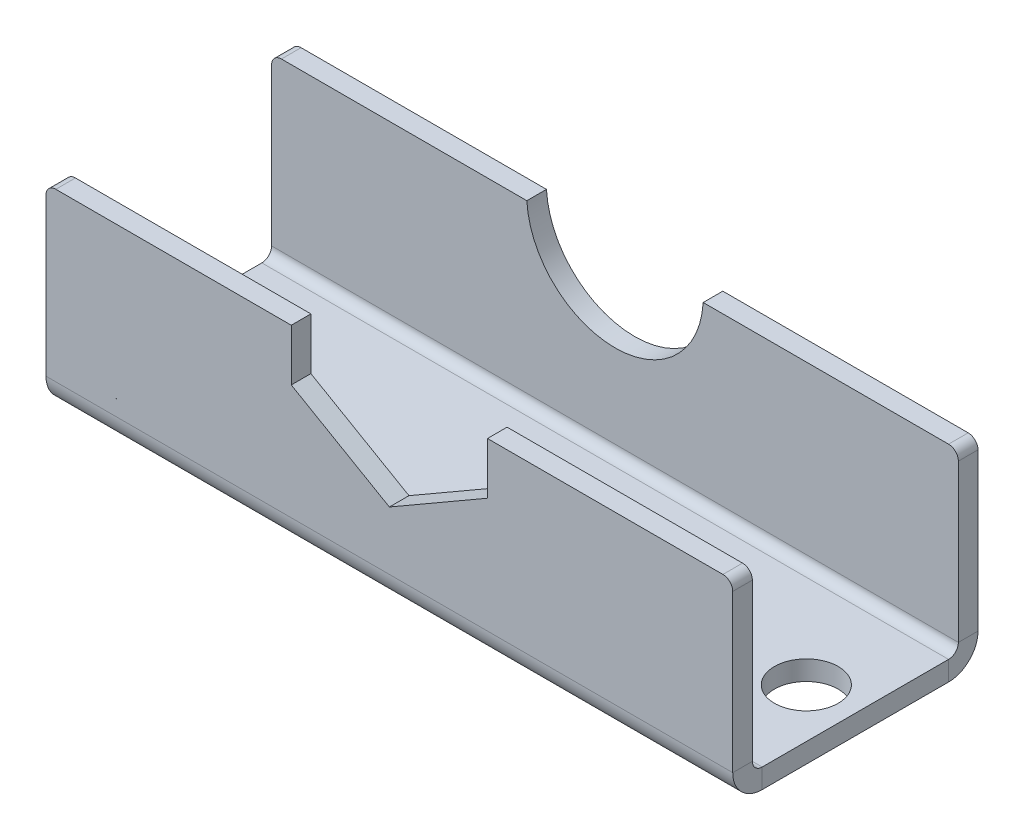
from build123d import *

# Parameters (mm, degrees)
BASE_FLANGE1_DEPTH = 70
CUT_EXTRUDE1_REACH = 78.974
CUT_EXTRUDE2_REACH = 78.348
SKETCH7_R          = 9
CUT_EXTRUDE3_REACH = 75.866
SKETCH8_R          = 3.25
FILLET1_R          = 1


# Sheet-metal steps are written as plain solids
with BuildPart() as part:
    # Sketch1 → Base-Flange1 (new body)
    with BuildSketch(Plane(origin=(0, 0, 0), x_dir=(0, 0, -1), z_dir=(1, 0, 0))):
        with BuildLine():
            Line((-12.5, 20), (-12.5, 3))
            ThreePointArc((-12.5, 3), (-11.621320344, 0.878679656), (-9.5, 0))
            Line((-9.5, 0), (9.5, 0))
            ThreePointArc((9.5, 0), (11.621320344, 0.878679656), (12.5, 3))
            Line((12.5, 3), (12.5, 20))
            Line((12.5, 20), (10.5, 20))
            Line((10.5, 20), (10.5, 3))
            ThreePointArc((10.5, 3), (10.207106781, 2.292893219), (9.5, 2))
            Line((9.5, 2), (-9.5, 2))
            ThreePointArc((-9.5, 2), (-10.207106781, 2.292893219), (-10.5, 3))
            Line((-10.5, 3), (-10.5, 20))
            Line((-10.5, 20), (-12.5, 20))
        make_face()
    extrude(amount=BASE_FLANGE1_DEPTH)

    # Sketch6 → Cut-Extrude1 (cut, up to next)
    with BuildSketch(Plane.XY.offset(12.5), mode=Mode.PRIVATE) as cut_extrude1_sk1:
        Polygon((35, 8.952994616), (45, 14.726497308), (45, 26.273502692), (35, 32.047005384), (25, 26.273502692), (25, 14.726497308), align=None)
    cut_extrude1_tool1 = extrude(cut_extrude1_sk1.sketch, amount=-CUT_EXTRUDE1_REACH, mode=Mode.PRIVATE) & part.part
    add(cut_extrude1_tool1.solids().sort_by_distance((35, 20.5, 12.5))[0], mode=Mode.SUBTRACT)

    # Sketch7 → Cut-Extrude2 (cut, up to next)
    with BuildSketch(Plane.XY.offset(-10.5), mode=Mode.PRIVATE) as cut_extrude2_sk1:
        with Locations((35, 20.5)):
            Circle(SKETCH7_R)
    cut_extrude2_tool1 = extrude(cut_extrude2_sk1.sketch, amount=-CUT_EXTRUDE2_REACH, mode=Mode.PRIVATE) & part.part
    add(cut_extrude2_tool1.solids().sort_by_distance((35, 20.5, -10.5))[0], mode=Mode.SUBTRACT)

    # Sketch8 → Cut-Extrude3 (cut, up to next)
    with BuildSketch(Plane.XZ, mode=Mode.PRIVATE) as cut_extrude3_sk1:
        with Locations(Location((65, 0, 0), (0, 0, 270))):
            Circle(SKETCH8_R)
    cut_extrude3_tool1 = extrude(cut_extrude3_sk1.sketch, amount=-CUT_EXTRUDE3_REACH, mode=Mode.PRIVATE) & part.part
    # Sketch8 → Cut-Extrude3 (cut, up to next)
    with BuildSketch(Plane.XZ, mode=Mode.PRIVATE) as cut_extrude3_sk2:
        with Locations(Location((5, 0, 0), (0, 0, 270))):
            Circle(SKETCH8_R)
    cut_extrude3_tool2 = extrude(cut_extrude3_sk2.sketch, amount=-CUT_EXTRUDE3_REACH, mode=Mode.PRIVATE) & part.part
    add(cut_extrude3_tool1.solids().sort_by_distance((65, 0, 0))[0], mode=Mode.SUBTRACT)
    add(cut_extrude3_tool2.solids().sort_by_distance((5, 0, 0))[0], mode=Mode.SUBTRACT)

    # Fillet1
    fillet1_edges = [part.edges().sort_by_distance(p)[0] for p in [
        (0, 20, -11.5),
        (0, 20, 11.5),
        (70, 20, -11.5),
        (70, 20, 11.5),
    ]]
    fillet(fillet1_edges, radius=FILLET1_R)


solid = part.part
